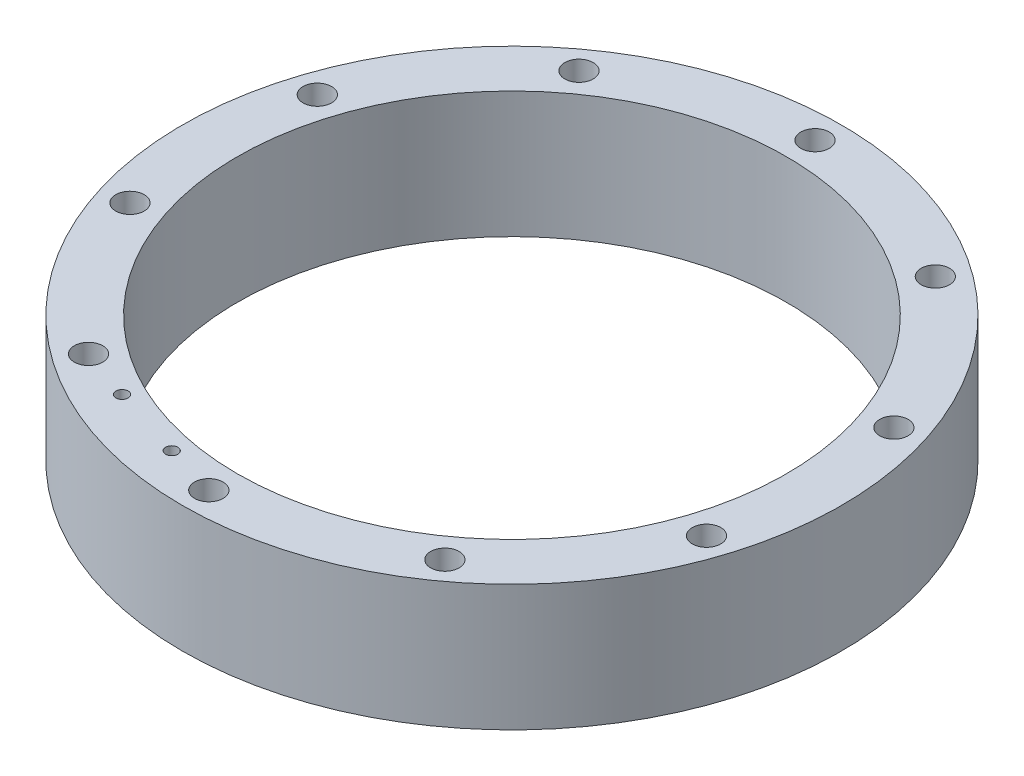
from build123d import *

# Parameters (mm, degrees)
SKETCH1_R           = 40.5
SKETCH1_R_2         = 1.75
SKETCH1_R_3         = 33.75
BOSS_EXTRUDE1_DEPTH = 15.5
SKETCH2_R           = 0.75
CUT_EXTRUDE1_DEPTH  = 60.335908184


with BuildPart() as part:
    # Sketch1 → Boss-Extrude1 (new body)
    with BuildSketch(Plane(origin=(0, 0, 0), x_dir=(1, 0, 0), z_dir=(0, 1, 0))):
        Circle(SKETCH1_R)
        with Locations((0, 37.25)):
            Circle(SKETCH1_R_2, mode=Mode.SUBTRACT)
        with Locations((21.895000648, 30.13588304)):
            Circle(SKETCH1_R_2, mode=Mode.SUBTRACT)
        with Locations((35.426855232, 11.51088304)):
            Circle(SKETCH1_R_2, mode=Mode.SUBTRACT)
        with Locations((35.426855232, -11.51088304)):
            Circle(SKETCH1_R_2, mode=Mode.SUBTRACT)
        with Locations((21.895000648, -30.13588304)):
            Circle(SKETCH1_R_2, mode=Mode.SUBTRACT)
        with Locations((0, -37.25)):
            Circle(SKETCH1_R_2, mode=Mode.SUBTRACT)
        with Locations((-21.895000648, -30.13588304)):
            Circle(SKETCH1_R_2, mode=Mode.SUBTRACT)
        with Locations((-35.426855232, -11.51088304)):
            Circle(SKETCH1_R_2, mode=Mode.SUBTRACT)
        with Locations((-35.426855232, 11.51088304)):
            Circle(SKETCH1_R_2, mode=Mode.SUBTRACT)
        with Locations((-21.895000648, 30.13588304)):
            Circle(SKETCH1_R_2, mode=Mode.SUBTRACT)
        Circle(SKETCH1_R_3, mode=Mode.SUBTRACT)
    extrude(amount=BOSS_EXTRUDE1_DEPTH)

    # Sketch2 → Cut-Extrude1 (cut, through all)
    with BuildSketch(Plane(origin=(0, 15.5, 0), x_dir=(1, 0, 0), z_dir=(0, 1, 0))):
        with Locations((-6.483486619, -35.325442924)):
            Circle(SKETCH2_R)
        with Locations((-15.518523524, -32.389781477)):
            Circle(SKETCH2_R)
    extrude(amount=-CUT_EXTRUDE1_DEPTH, mode=Mode.SUBTRACT)


solid = part.part
